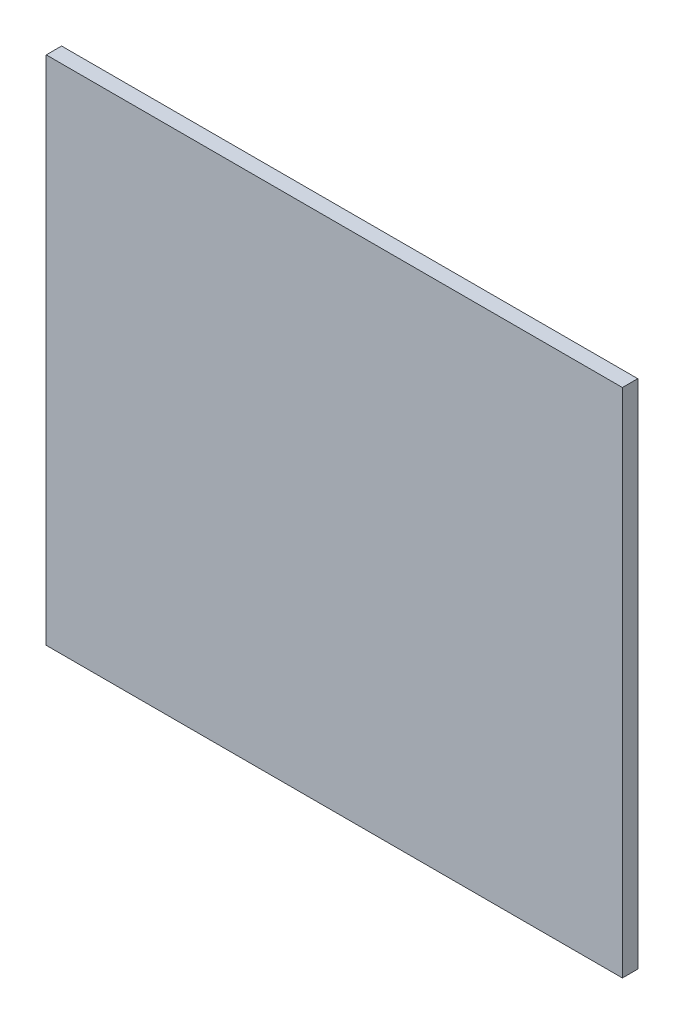
from build123d import *

# Parameters (mm, degrees)
SKETCH1_W           = 338
SKETCH1_H           = 300
BOSS_EXTRUDE1_DEPTH = 9


with BuildPart() as part:
    # Sketch1 → Boss-Extrude1 (new body)
    with BuildSketch(Plane.XY):
        Rectangle(SKETCH1_W, SKETCH1_H)
    extrude(amount=BOSS_EXTRUDE1_DEPTH)


solid = part.part
